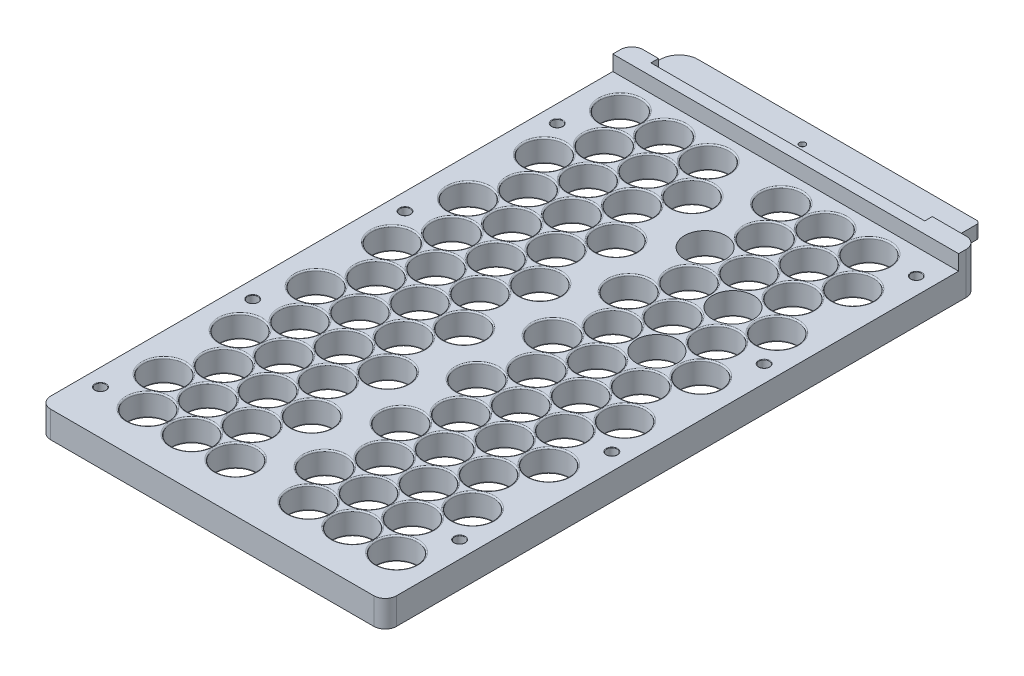
from build123d import *

# Parameters (mm, degrees)
CELL_BLOCK_SKETCH_W = 164.3
CELL_BLOCK_SKETCH_H = 312.280345268
BOSS_EXTRUDE1_DEPTH = 12
SKETCH3_W           = 9
SKETCH3_H           = 312.280345268
BOSS_EXTRUDE2_DEPTH = 12
HOLE_PATTERN_R      = 10.825
CUT_EXTRUDE1_DEPTH  = 12
SKETCH4_R           = 2.75
CUT_EXTRUDE2_DEPTH  = 12
SKETCH5_W           = 158.69
SKETCH5_H           = 25
BOSS_EXTRUDE3_DEPTH = 5
FILLET1_R           = 10
SKETCH7_W           = 182.3
SKETCH7_H           = 10
BOSS_EXTRUDE4_DEPTH = 8
SKETCH8_W           = 144.315
SKETCH8_H           = 54.74
CUT_EXTRUDE3_DEPTH  = 4
SKETCH9_R           = 2.8575
CUT_EXTRUDE4_DEPTH  = 5
SKETCH15_W          = 176.3
SKETCH15_H          = 296.280345268
BOSS_EXTRUDE5_DEPTH = 2
FILLET6_R           = 6
FILLET7_R           = 0.7
FILLET8_R           = 2
FILLET9_R           = 0.25
FILLET10_R          = 10


with BuildPart() as part:
    # Cell Block Sketch → Boss-Extrude1 (new body)
    with BuildSketch(Plane(origin=(0, 0, 0), x_dir=(1, 0, 0), z_dir=(0, 1, 0))):
        Rectangle(CELL_BLOCK_SKETCH_W, CELL_BLOCK_SKETCH_H)
    extrude(amount=BOSS_EXTRUDE1_DEPTH)

    # Sketch3 → Boss-Extrude2 (add)
    with BuildSketch(Plane(origin=(0, 0, 0), x_dir=(1, 0, 0), z_dir=(0, 1, 0))):
        with Locations((-86.65, 0)):
            Rectangle(SKETCH3_W, SKETCH3_H)
    boss_extrude2 = extrude(amount=BOSS_EXTRUDE2_DEPTH)

    # Mirror1: Boss-Extrude2 across plane
    add(boss_extrude2.mirror(Plane(origin=(0, 0, 0), x_dir=(0, 0, 1), z_dir=(1, 0, 0))))

    # Hole Pattern → Cut-Extrude1 (cut)
    with BuildSketch(Plane(origin=(0, 12, 0), x_dir=(1, 0, 0), z_dir=(0, 1, 0))):
        with Locations(Location((-71.325, -110.266684537, 0), (0, 0, 270))):
            Circle(HOLE_PATTERN_R)
        with Locations(Location((-59.75, -130.315172634, 0), (0, 0, 270))):
            Circle(HOLE_PATTERN_R)
        with Locations(Location((-71.325, -70.169708342, 0), (0, 0, 270))):
            Circle(HOLE_PATTERN_R)
        with Locations(Location((-59.75, -90.218196439, 0), (0, 0, 270))):
            Circle(HOLE_PATTERN_R)
        with Locations(Location((-71.325, -30.072732146, 0), (0, 0, 270))):
            Circle(HOLE_PATTERN_R)
        with Locations(Location((-59.75, -50.121220244, 0), (0, 0, 270))):
            Circle(HOLE_PATTERN_R)
        with Locations(Location((-71.325, 10.024244049, 0), (0, 0, 270))):
            Circle(HOLE_PATTERN_R)
        with Locations(Location((-59.75, -10.024244049, 0), (0, 0, 270))):
            Circle(HOLE_PATTERN_R)
        with Locations(Location((-71.325, 50.121220244, 0), (0, 0, 270))):
            Circle(HOLE_PATTERN_R)
        with Locations(Location((-59.75, 30.072732146, 0), (0, 0, 270))):
            Circle(HOLE_PATTERN_R)
        with Locations(Location((-71.325, 90.218196439, 0), (0, 0, 270))):
            Circle(HOLE_PATTERN_R)
        with Locations(Location((-59.75, 70.169708342, 0), (0, 0, 270))):
            Circle(HOLE_PATTERN_R)
        with Locations(Location((-71.325, 130.315172634, 0), (0, 0, 270))):
            Circle(HOLE_PATTERN_R)
        with Locations(Location((-59.75, 110.266684537, 0), (0, 0, 270))):
            Circle(HOLE_PATTERN_R)
        with Locations(Location((-48.175, -70.169708342, 0), (0, 0, 270))):
            Circle(HOLE_PATTERN_R)
        with Locations(Location((-36.6, -90.218196439, 0), (0, 0, 270))):
            Circle(HOLE_PATTERN_R)
        with Locations(Location((-48.175, -30.072732146, 0), (0, 0, 270))):
            Circle(HOLE_PATTERN_R)
        with Locations(Location((-36.6, -50.121220244, 0), (0, 0, 270))):
            Circle(HOLE_PATTERN_R)
        with Locations(Location((-48.175, 10.024244049, 0), (0, 0, 270))):
            Circle(HOLE_PATTERN_R)
        with Locations(Location((-36.6, -10.024244049, 0), (0, 0, 270))):
            Circle(HOLE_PATTERN_R)
        with Locations(Location((-48.175, 50.121220244, 0), (0, 0, 270))):
            Circle(HOLE_PATTERN_R)
        with Locations(Location((-36.6, 30.072732146, 0), (0, 0, 270))):
            Circle(HOLE_PATTERN_R)
        with Locations(Location((-48.175, 90.218196439, 0), (0, 0, 270))):
            Circle(HOLE_PATTERN_R)
        with Locations(Location((-36.6, 70.169708342, 0), (0, 0, 270))):
            Circle(HOLE_PATTERN_R)
        with Locations(Location((-48.175, 130.315172634, 0), (0, 0, 270))):
            Circle(HOLE_PATTERN_R)
        with Locations(Location((-36.6, 110.266684537, 0), (0, 0, 270))):
            Circle(HOLE_PATTERN_R)
        with Locations(Location((-25.025, -70.169708342, 0), (0, 0, 270))):
            Circle(HOLE_PATTERN_R)
        with Locations(Location((-13.45, -90.218196439, 0), (0, 0, 270))):
            Circle(HOLE_PATTERN_R)
        with Locations(Location((-25.025, -30.072732146, 0), (0, 0, 270))):
            Circle(HOLE_PATTERN_R)
        with Locations(Location((-13.45, -50.121220244, 0), (0, 0, 270))):
            Circle(HOLE_PATTERN_R)
        with Locations(Location((-25.025, 10.024244049, 0), (0, 0, 270))):
            Circle(HOLE_PATTERN_R)
        with Locations(Location((-13.45, -10.024244049, 0), (0, 0, 270))):
            Circle(HOLE_PATTERN_R)
        with Locations(Location((-25.025, 50.121220244, 0), (0, 0, 270))):
            Circle(HOLE_PATTERN_R)
        with Locations(Location((-13.45, 30.072732146, 0), (0, 0, 270))):
            Circle(HOLE_PATTERN_R)
        with Locations(Location((-25.025, 90.218196439, 0), (0, 0, 270))):
            Circle(HOLE_PATTERN_R)
        with Locations(Location((-13.45, 70.169708342, 0), (0, 0, 270))):
            Circle(HOLE_PATTERN_R)
        with Locations(Location((-25.025, 130.315172634, 0), (0, 0, 270))):
            Circle(HOLE_PATTERN_R)
        with Locations(Location((-13.45, 110.266684537, 0), (0, 0, 270))):
            Circle(HOLE_PATTERN_R)
        with Locations(Location((-48.175, -110.266684537, 0), (0, 0, 270))):
            Circle(HOLE_PATTERN_R)
        with Locations(Location((-36.6, -130.315172634, 0), (0, 0, 270))):
            Circle(HOLE_PATTERN_R)
        with Locations(Location((-25.025, -110.266684537, 0), (0, 0, 270))):
            Circle(HOLE_PATTERN_R)
        with Locations(Location((-13.45, -130.315172634, 0), (0, 0, 270))):
            Circle(HOLE_PATTERN_R)
        with Locations(Location((71.325, -130.315172634, 0), (0, 0, 270))):
            Circle(HOLE_PATTERN_R)
        with Locations(Location((59.75, -110.266684537, 0), (0, 0, 270))):
            Circle(HOLE_PATTERN_R)
        with Locations(Location((36.6, -110.266684537, 0), (0, 0, 270))):
            Circle(HOLE_PATTERN_R)
        with Locations(Location((48.175, -130.315172634, 0), (0, 0, 270))):
            Circle(HOLE_PATTERN_R)
        with Locations(Location((13.45, -110.266684537, 0), (0, 0, 270))):
            Circle(HOLE_PATTERN_R)
        with Locations(Location((25.025, -130.315172634, 0), (0, 0, 270))):
            Circle(HOLE_PATTERN_R)
        with Locations(Location((36.6, -70.169708342, 0), (0, 0, 270))):
            Circle(HOLE_PATTERN_R)
        with Locations(Location((48.175, -90.218196439, 0), (0, 0, 270))):
            Circle(HOLE_PATTERN_R)
        with Locations(Location((13.45, -70.169708342, 0), (0, 0, 270))):
            Circle(HOLE_PATTERN_R)
        with Locations(Location((25.025, -90.218196439, 0), (0, 0, 270))):
            Circle(HOLE_PATTERN_R)
        with Locations(Location((36.6, -30.072732146, 0), (0, 0, 270))):
            Circle(HOLE_PATTERN_R)
        with Locations(Location((48.175, -50.121220244, 0), (0, 0, 270))):
            Circle(HOLE_PATTERN_R)
        with Locations(Location((13.45, -30.072732146, 0), (0, 0, 270))):
            Circle(HOLE_PATTERN_R)
        with Locations(Location((25.025, -50.121220244, 0), (0, 0, 270))):
            Circle(HOLE_PATTERN_R)
        with Locations(Location((36.6, 10.024244049, 0), (0, 0, 270))):
            Circle(HOLE_PATTERN_R)
        with Locations(Location((48.175, -10.024244049, 0), (0, 0, 270))):
            Circle(HOLE_PATTERN_R)
        with Locations(Location((13.45, 10.024244049, 0), (0, 0, 270))):
            Circle(HOLE_PATTERN_R)
        with Locations(Location((25.025, -10.024244049, 0), (0, 0, 270))):
            Circle(HOLE_PATTERN_R)
        with Locations(Location((36.6, 50.121220244, 0), (0, 0, 270))):
            Circle(HOLE_PATTERN_R)
        with Locations(Location((48.175, 30.072732146, 0), (0, 0, 270))):
            Circle(HOLE_PATTERN_R)
        with Locations(Location((13.45, 50.121220244, 0), (0, 0, 270))):
            Circle(HOLE_PATTERN_R)
        with Locations(Location((25.025, 30.072732146, 0), (0, 0, 270))):
            Circle(HOLE_PATTERN_R)
        with Locations(Location((36.6, 90.218196439, 0), (0, 0, 270))):
            Circle(HOLE_PATTERN_R)
        with Locations(Location((48.175, 70.169708342, 0), (0, 0, 270))):
            Circle(HOLE_PATTERN_R)
        with Locations(Location((13.45, 90.218196439, 0), (0, 0, 270))):
            Circle(HOLE_PATTERN_R)
        with Locations(Location((25.025, 70.169708342, 0), (0, 0, 270))):
            Circle(HOLE_PATTERN_R)
        with Locations(Location((36.6, 130.315172634, 0), (0, 0, 270))):
            Circle(HOLE_PATTERN_R)
        with Locations(Location((48.175, 110.266684537, 0), (0, 0, 270))):
            Circle(HOLE_PATTERN_R)
        with Locations(Location((13.45, 130.315172634, 0), (0, 0, 270))):
            Circle(HOLE_PATTERN_R)
        with Locations(Location((25.025, 110.266684537, 0), (0, 0, 270))):
            Circle(HOLE_PATTERN_R)
        with Locations(Location((59.75, -70.169708342, 0), (0, 0, 270))):
            Circle(HOLE_PATTERN_R)
        with Locations(Location((71.325, -90.218196439, 0), (0, 0, 270))):
            Circle(HOLE_PATTERN_R)
        with Locations(Location((59.75, -30.072732146, 0), (0, 0, 270))):
            Circle(HOLE_PATTERN_R)
        with Locations(Location((71.325, -50.121220244, 0), (0, 0, 270))):
            Circle(HOLE_PATTERN_R)
        with Locations(Location((59.75, 10.024244049, 0), (0, 0, 270))):
            Circle(HOLE_PATTERN_R)
        with Locations(Location((71.325, -10.024244049, 0), (0, 0, 270))):
            Circle(HOLE_PATTERN_R)
        with Locations(Location((59.75, 50.121220244, 0), (0, 0, 270))):
            Circle(HOLE_PATTERN_R)
        with Locations(Location((71.325, 30.072732146, 0), (0, 0, 270))):
            Circle(HOLE_PATTERN_R)
        with Locations(Location((59.75, 90.218196439, 0), (0, 0, 270))):
            Circle(HOLE_PATTERN_R)
        with Locations(Location((71.325, 70.169708342, 0), (0, 0, 270))):
            Circle(HOLE_PATTERN_R)
        with Locations(Location((59.75, 130.315172634, 0), (0, 0, 270))):
            Circle(HOLE_PATTERN_R)
        with Locations(Location((71.325, 110.266684537, 0), (0, 0, 270))):
            Circle(HOLE_PATTERN_R)
    extrude(amount=-CUT_EXTRUDE1_DEPTH, mode=Mode.SUBTRACT)

    # Sketch4 → Cut-Extrude2 (cut)
    with BuildSketch(Plane(origin=(0, 12, 0), x_dir=(1, 0, 0), z_dir=(0, 1, 0))):
        with Locations(Location((-82.15, 27.609827366, 0), (0, 0, 270))):
            Circle(SKETCH4_R)
        with Locations(Location((-82.15, -52.640172634, 0), (0, 0, 270))):
            Circle(SKETCH4_R)
        with Locations(Location((-82.15, -132.890172634, 0), (0, 0, 270))):
            Circle(SKETCH4_R)
        with Locations(Location((82.15, -107.890172634, 0), (0, 0, 270))):
            Circle(SKETCH4_R)
        with Locations(Location((82.15, -27.640172634, 0), (0, 0, 270))):
            Circle(SKETCH4_R)
        with Locations(Location((82.15, 52.609827366, 0), (0, 0, 270))):
            Circle(SKETCH4_R)
        with Locations(Location((-82.15, 107.859827366, 0), (0, 0, 270))):
            Circle(SKETCH4_R)
        with Locations(Location((82.15, 132.859827366, 0), (0, 0, 270))):
            Circle(SKETCH4_R)
    extrude(amount=-CUT_EXTRUDE2_DEPTH, mode=Mode.SUBTRACT)

    # Sketch5 → Boss-Extrude3 (add)
    with BuildSketch(Plane(origin=(0, 0, 0), x_dir=(1, 0, 0), z_dir=(0, 1, 0))):
        with Locations((-11.805, 168.640172634)):
            Rectangle(SKETCH5_W, SKETCH5_H)
    extrude(amount=BOSS_EXTRUDE3_DEPTH)

    # Fillet1
    fillet1_edges = [part.edges().sort_by_distance(p)[0] for p in [
        (-91.15, 2.5, -181.140172634),
    ]]
    fillet(fillet1_edges, radius=FILLET1_R)

    # Sketch7 → Boss-Extrude4 (add)
    with BuildSketch(Plane(origin=(0, 12, 0), x_dir=(1, 0, 0), z_dir=(0, 1, 0))):
        with Locations((0, 151.140172634)):
            Rectangle(SKETCH7_W, SKETCH7_H)
    extrude(amount=BOSS_EXTRUDE4_DEPTH)

    # Sketch8 → Cut-Extrude3 (cut)
    with BuildSketch(Plane(origin=(0, 0, -156.140172634), x_dir=(-1, 0, 0), z_dir=(0, 0, -1))):
        with Locations((4.8925, 34.78)):
            Rectangle(SKETCH8_W, SKETCH8_H)
    extrude(amount=-CUT_EXTRUDE3_DEPTH, mode=Mode.SUBTRACT)

    # Sketch9 → Cut-Extrude4 (cut)
    with BuildSketch(Plane(origin=(0, 0, -152.140172634), x_dir=(-1, 0, 0), z_dir=(0, 0, -1))):
        with Locations((-60.185, 13.49)):
            Circle(SKETCH9_R)
        with Locations((4.585, 13.49)):
            Circle(SKETCH9_R)
        with Locations((69.355, 13.49)):
            Circle(SKETCH9_R)
    extrude(amount=-CUT_EXTRUDE4_DEPTH, mode=Mode.SUBTRACT)

    # Sketch15 → Boss-Extrude5 (add)
    with BuildSketch(Plane.XZ):
        with BuildLine():
            Line((91.15, -156.140172634), (91.15, 156.140172634))
            Line((91.15, 156.140172634), (-91.15, 156.140172634))
            Line((-91.15, 156.140172634), (-91.15, -171.140172634))
            ThreePointArc((-91.15, -171.140172634), (-88.221067812, -178.211240446), (-81.15, -181.140172634))
            Line((-81.15, -181.140172634), (67.54, -181.140172634))
            Line((67.54, -181.140172634), (67.54, -156.140172634))
            Line((67.54, -156.140172634), (91.15, -156.140172634))
        make_face()
        with Locations((0, 2)):
            Rectangle(SKETCH15_W, SKETCH15_H, mode=Mode.SUBTRACT)
    extrude(amount=BOSS_EXTRUDE5_DEPTH)

    # Sketch17 → CSK for #4 Flat Head Socket Cap Screw1 (revolve, cut)
    with BuildSketch(Plane(origin=(-14.96, -2, -169.890172634), x_dir=(0, 0, -1), z_dir=(1, 0, 0))):
        Polygon((0, 0), (0, 14.980574487), (1.63195, 14), (1.63195, 4.848124365), (3.2385, 3), (3.2385, 0), align=None)
    revolve(axis=Axis((-14.96, -8.35, -169.890172634), (0, 1, 0)), mode=Mode.SUBTRACT)

    # Fillet6
    fillet6_edges = [part.edges().sort_by_distance(p)[0] for p in [
        (-91.15, 12.5, -156.140172634),
        (-91.15, 5, 156.140172634),
        (91.15, 5, 156.140172634),
        (91.15, 9, -156.140172634),
    ]]
    fillet(fillet6_edges, radius=FILLET6_R)

    # Fillet7
    fillet7_edges = [part.edges().sort_by_distance(p)[0] for p in [
        (-71.325, 12, -60.946220244),
        (-71.325, 0, -60.946220244),
        (59.75, 12, 99.441684537),
        (59.75, 0, 99.441684537),
        (-71.325, 12, 59.344708342),
        (-71.325, 0, 59.344708342),
        (-59.75, 12, 119.490172634),
        (-59.75, 0, 119.490172634),
        (-71.325, 12, 19.247732146),
        (-71.325, 0, 19.247732146),
        (-59.75, 12, -40.897732146),
        (-59.75, 0, -40.897732146),
        (-71.325, 12, -101.043196439),
        (-71.325, 0, -101.043196439),
        (-59.75, 12, -0.800755951),
        (-59.75, 0, -0.800755951),
        (-36.6, 12, -121.091684537),
        (-36.6, 0, -121.091684537),
        (-25.025, 12, 59.344708342),
        (-25.025, 0, 59.344708342),
        (-36.6, 12, -80.994708342),
        (-36.6, 0, -80.994708342),
        (-48.175, 12, -141.140172634),
        (-48.175, 0, -141.140172634),
        (-36.6, 12, -40.897732146),
        (-36.6, 0, -40.897732146),
        (-48.175, 12, -101.043196439),
        (-48.175, 0, -101.043196439),
        (-36.6, 12, -0.800755951),
        (-36.6, 0, -0.800755951),
        (-48.175, 12, -60.946220244),
        (-48.175, 0, -60.946220244),
        (48.175, 12, -0.800755951),
        (48.175, 0, -0.800755951),
        (13.45, 12, 99.441684537),
        (13.45, 0, 99.441684537),
        (36.6, 12, 99.441684537),
        (36.6, 0, 99.441684537),
        (25.025, 12, 119.490172634),
        (25.025, 0, 119.490172634),
        (48.175, 12, 39.296220244),
        (48.175, 0, 39.296220244),
        (13.45, 12, -20.849244049),
        (13.45, 0, -20.849244049),
        (36.6, 12, -20.849244049),
        (36.6, 0, -20.849244049),
        (25.025, 12, -0.800755951),
        (25.025, 0, -0.800755951),
        (48.175, 12, 79.393196439),
        (48.175, 0, 79.393196439),
        (-59.75, 12, 39.296220244),
        (-59.75, 0, 39.296220244),
        (-71.325, 12, -20.849244049),
        (-71.325, 0, -20.849244049),
        (-59.75, 12, 79.393196439),
        (-59.75, 0, 79.393196439),
        (48.175, 12, 119.490172634),
        (48.175, 0, 119.490172634),
        (13.45, 12, 59.344708342),
        (13.45, 0, 59.344708342),
        (36.6, 12, 59.344708342),
        (36.6, 0, 59.344708342),
        (25.025, 12, 79.393196439),
        (25.025, 0, 79.393196439),
        (25.025, 12, -80.994708342),
        (25.025, 0, -80.994708342),
        (13.45, 0, -101.043196439),
        (48.175, 0, -80.994708342),
        (36.6, 12, -101.043196439),
        (36.6, 0, -101.043196439),
        (25.025, 12, -40.897732146),
        (25.025, 0, -40.897732146),
        (13.45, 12, -60.946220244),
        (13.45, 0, -60.946220244),
        (48.175, 0, -40.897732146),
        (36.6, 12, -60.946220244),
        (36.6, 0, -60.946220244),
        (71.325, 12, -121.091684537),
        (71.325, 0, -121.091684537),
        (59.75, 12, -141.140172634),
        (59.75, 0, -141.140172634),
        (71.325, 12, -80.994708342),
        (71.325, 0, -80.994708342),
        (59.75, 12, -101.043196439),
        (59.75, 0, -101.043196439),
        (71.325, 12, -40.897732146),
        (71.325, 0, -40.897732146),
        (59.75, 12, -60.946220244),
        (59.75, 0, -60.946220244),
        (71.325, 12, -0.800755951),
        (71.325, 0, -0.800755951),
        (59.75, 12, -20.849244049),
        (59.75, 0, -20.849244049),
        (71.325, 12, 39.296220244),
        (71.325, 0, 39.296220244),
        (59.75, 12, 19.247732146),
        (59.75, 0, 19.247732146),
        (71.325, 12, 79.393196439),
        (71.325, 0, 79.393196439),
        (59.75, 12, 59.344708342),
        (59.75, 0, 59.344708342),
        (25.025, 12, -121.091684537),
        (25.025, 0, -121.091684537),
        (13.45, 12, -141.140172634),
        (13.45, 0, -141.140172634),
        (48.175, 12, -121.091684537),
        (48.175, 0, -121.091684537),
        (36.6, 12, -141.140172634),
        (36.6, 0, -141.140172634),
        (-71.325, 12, -141.140172634),
        (-71.325, 0, -141.140172634),
        (-59.75, 12, -80.994708342),
        (-59.75, 0, -80.994708342),
        (-48.175, 12, 59.344708342),
        (-48.175, 0, 59.344708342),
        (-59.75, 12, -121.091684537),
        (-59.75, 0, -121.091684537),
        (-48.175, 12, 19.247732146),
        (-48.175, 0, 19.247732146),
        (-36.6, 12, 79.393196439),
        (-36.6, 0, 79.393196439),
        (-48.175, 12, -20.849244049),
        (-48.175, 0, -20.849244049),
        (-36.6, 12, 39.296220244),
        (-36.6, 0, 39.296220244),
        (-13.45, 12, -121.091684537),
        (-13.45, 0, -121.091684537),
        (-48.175, 12, 99.441684537),
        (-48.175, 0, 99.441684537),
        (-13.45, 12, -80.994708342),
        (-13.45, 0, -80.994708342),
        (-13.45, 12, -0.800755951),
        (-13.45, 0, -0.800755951),
        (-25.025, 12, -101.043196439),
        (-25.025, 0, -101.043196439),
        (-13.45, 12, -40.897732146),
        (-13.45, 0, -40.897732146),
        (-25.025, 12, 19.247732146),
        (-25.025, 0, 19.247732146),
        (25.025, 12, 39.296220244),
        (25.025, 0, 39.296220244),
        (36.6, 12, 19.247732146),
        (36.6, 0, 19.247732146),
        (13.45, 12, 19.247732146),
        (13.45, 0, 19.247732146),
        (-25.025, 12, -60.946220244),
        (-25.025, 0, -60.946220244),
        (-36.6, 12, 119.490172634),
        (-36.6, 0, 119.490172634),
        (71.325, 12, 119.490172634),
        (71.325, 0, 119.490172634),
        (-13.45, 12, 119.490172634),
        (-13.45, 0, 119.490172634),
        (-25.025, 12, -141.140172634),
        (-25.025, 0, -141.140172634),
        (-13.45, 12, 79.393196439),
        (-13.45, 0, 79.393196439),
        (-25.025, 12, -20.849244049),
        (-25.025, 0, -20.849244049),
        (-13.45, 12, 39.296220244),
        (-13.45, 0, 39.296220244),
        (-25.025, 12, 99.441684537),
        (-25.025, 0, 99.441684537),
        (-71.325, 12, 99.441684537),
        (-71.325, 0, 99.441684537),
    ]]
    fillet(fillet7_edges, radius=FILLET7_R)

    # Fillet8
    fillet8_edges = [part.edges().sort_by_distance(p)[0] for p in [
        (67.54, 1.5, -181.140172634),
    ]]
    fillet(fillet8_edges, radius=FILLET8_R)

    # Fillet9
    fillet9_edges = [part.edges().sort_by_distance(p)[0] for p in [
        (82.15, 12, -135.609827366),
        (82.15, 0, -135.609827366),
        (-82.15, 12, -110.609827366),
        (-82.15, 0, -110.609827366),
        (82.15, 12, -55.359827366),
        (82.15, 0, -55.359827366),
        (82.15, 12, 24.890172634),
        (82.15, 0, 24.890172634),
        (82.15, 12, 105.140172634),
        (82.15, 0, 105.140172634),
        (-82.15, 12, 130.140172634),
        (-82.15, 0, 130.140172634),
        (-82.15, 12, 49.890172634),
        (-82.15, 0, 49.890172634),
        (-82.15, 12, -30.359827366),
        (-82.15, 0, -30.359827366),
    ]]
    fillet(fillet9_edges, radius=FILLET9_R)

    # Fillet10
    fillet10_edges = [part.edges().sort_by_distance(p)[0] for p in [
        (-88.15, -1, -146.140172634),
        (88.15, -1, 150.140172634),
        (-88.15, -1, 150.140172634),
        (88.15, -1, -146.140172634),
    ]]
    fillet(fillet10_edges, radius=FILLET10_R)


solid = part.part
